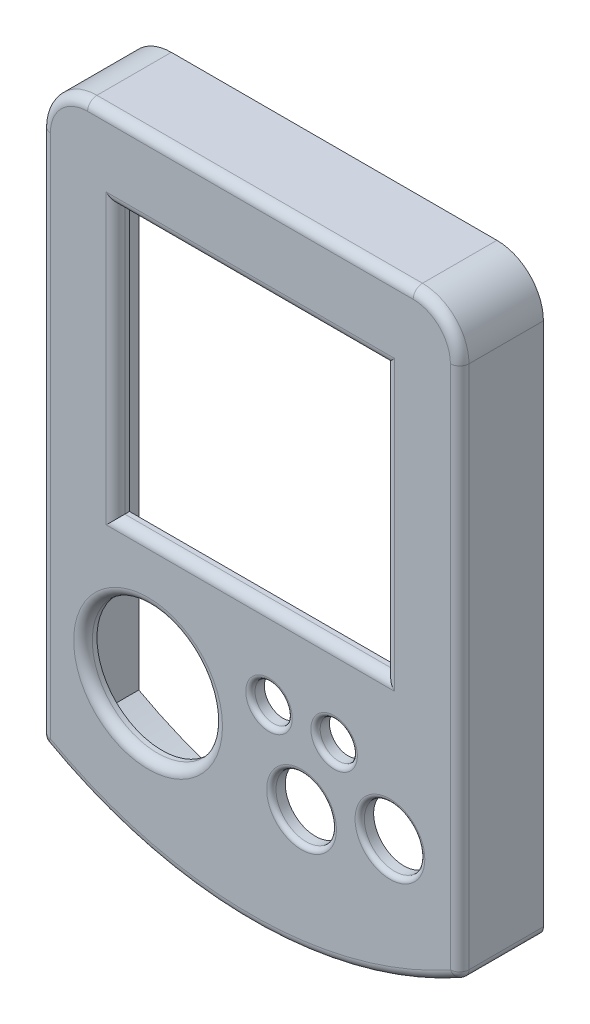
from build123d import *

# Parameters (mm, degrees)
EXTRUDE_1_DEPTH     = 9
CUT_EXTRUDE_2_DEPTH = 83.036577208
SHELL_2_T           = -1.5
SKETCH_4_R          = 7
SKETCH_4_R_2        = 3.25
SKETCH_4_R_3        = 2
SKETCH_4_W          = 29
SKETCH_4_H          = 29
CUT_EXTRUDE_3_DEPTH = 83.036577208
FILLET_1_R          = 1
FILLET_2_R          = 1
FILLET_3_R          = 0.5
FILLET_5_R          = 1
FILLET_7_R          = 1


with BuildPart() as part:
    # 草图1 → 凸台-拉伸1 (new body)
    with BuildSketch(Plane.XY):
        with BuildLine():
            Line((-40, 68), (-5, 68))
            ThreePointArc((-5, 68), (-1.464466094, 66.535533906), (0, 63))
            Line((0, 63), (0, 0))
            Line((0, 0), (-45, 0))
            Line((-45, 0), (-45, 63))
            ThreePointArc((-45, 63), (-43.535533906, 66.535533906), (-40, 68))
        make_face()
    extrude(amount=EXTRUDE_1_DEPTH)

    # 草图3 → 切除-拉伸2 (cut, through all)
    with BuildSketch(Plane(origin=(0, 0, 0), x_dir=(-1, 0, 0), z_dir=(0, 0, -1))):
        with BuildLine():
            Line((0, 0), (22.5, 0))
            ThreePointArc((22.5, 0), (10.856868978, 1.525758667), (0, 6))
            Line((0, 6), (0, 0))
        make_face()
        with BuildLine():
            Line((45, 0), (45, 6))
            ThreePointArc((45, 6), (34.143131022, 1.525758667), (22.5, 0))
            Line((22.5, 0), (45, 0))
        make_face()
    extrude(amount=-CUT_EXTRUDE_2_DEPTH, mode=Mode.SUBTRACT)

    # 抽壳2
    shell_2_openings = [part.faces().sort_by_distance(p)[0] for p in [
        (-22.5, 34.832437255, 0),
    ]]
    offset(amount=SHELL_2_T, openings=shell_2_openings, kind=Kind.INTERSECTION)

    # 草图4 → 切除-拉伸3 (cut, through all)
    with BuildSketch(Plane(origin=(0, 0, 0), x_dir=(-1, 0, 0), z_dir=(0, 0, -1))):
        with Locations((33.5, 17)):
            Circle(SKETCH_4_R)
        with Locations((7.5, 15.5)):
            Circle(SKETCH_4_R_2)
        with Locations((17, 13.5)):
            Circle(SKETCH_4_R_2)
        with Locations((13.5, 21.5)):
            Circle(SKETCH_4_R_3)
        with Locations((20.5, 21.5)):
            Circle(SKETCH_4_R_3)
        with Locations((22.5, 45)):
            Rectangle(SKETCH_4_W, SKETCH_4_H)
    extrude(amount=-CUT_EXTRUDE_3_DEPTH, mode=Mode.SUBTRACT)

    # 圆角1
    fillet_1_edges = [part.edges().sort_by_distance(p)[0] for p in [
        (-22.5, 59.5, 9),
        (-8, 45, 9),
        (-22.5, 30.5, 9),
        (-37, 45, 9),
    ]]
    fillet(fillet_1_edges, radius=FILLET_1_R)

    # 圆角2
    fillet_2_edges = [part.edges().sort_by_distance(p)[0] for p in [
        (-26.5, 17, 9),
    ]]
    fillet(fillet_2_edges, radius=FILLET_2_R)

    # 圆角3
    fillet_3_edges = [part.edges().sort_by_distance(p)[0] for p in [
        (-11.5, 21.5, 9),
        (-18.5, 21.5, 9),
        (-4.25, 15.5, 9),
        (-13.75, 13.5, 9),
    ]]
    fillet(fillet_3_edges, radius=FILLET_3_R)

    # 圆角5
    fillet_5_edges = [part.edges().sort_by_distance(p)[0] for p in [
        (0, 6, 4.5),
        (-45, 6, 4.5),
    ]]
    fillet(fillet_5_edges, radius=FILLET_5_R)

    # 圆角7
    fillet_7_edges = [part.edges().sort_by_distance(p)[0] for p in [
        (-0.137862267, 6.076614374, 9),
        (-44.862137733, 6.076614374, 9),
        (-22.5, 0, 9),
        (-45, 34.791644181, 9),
        (-43.535533906, 66.535533906, 9),
        (0, 34.791644181, 9),
        (-1.464466094, 66.535533906, 9),
        (-22.5, 68, 9),
    ]]
    fillet(fillet_7_edges, radius=FILLET_7_R)


solid = part.part
